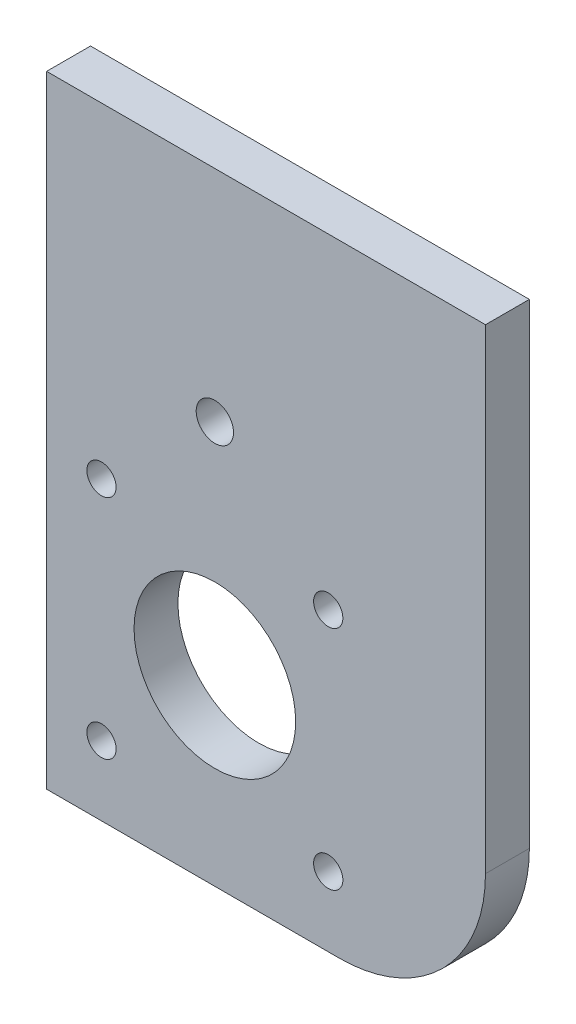
from build123d import *

# Parameters (mm, degrees)
EXTRUDE_1_DEPTH     = 6
SKETCH_2_R          = 11.05
SKETCH_2_R_2        = 2
SKETCH_2_R_3        = 2.55
CUT_EXTRUDE_1_DEPTH = 385.599022729


with BuildPart() as part:
    # Эскиз1 → Бобышка-Вытянуть1 (new body)
    with BuildSketch(Plane.XY):
        with BuildLine():
            Line((6, -293.846153846), (6, -378.846153846))
            Line((6, -378.846153846), (46, -378.846153846))
            ThreePointArc((46, -378.846153846), (60.142135624, -372.98828947), (66, -358.846153846))
            Line((66, -358.846153846), (66, -293.846153846))
            Line((66, -293.846153846), (6, -293.846153846))
        make_face()
    extrude(amount=-EXTRUDE_1_DEPTH)

    # Эскиз2 → Вырез-Вытянуть1 (cut, through all)
    with BuildSketch(Plane.XY):
        with Locations((29, -353.846153846)):
            Circle(SKETCH_2_R)
        with Locations((44.5, -369.346153846)):
            Circle(SKETCH_2_R_2)
        with Locations((13.5, -369.346153846)):
            Circle(SKETCH_2_R_2)
        with Locations((13.5, -338.346153846)):
            Circle(SKETCH_2_R_2)
        with Locations((44.5, -338.346153846)):
            Circle(SKETCH_2_R_2)
        with Locations((29, -323.846153846)):
            Circle(SKETCH_2_R_3)
    extrude(amount=-CUT_EXTRUDE_1_DEPTH, mode=Mode.SUBTRACT)


solid = part.part
